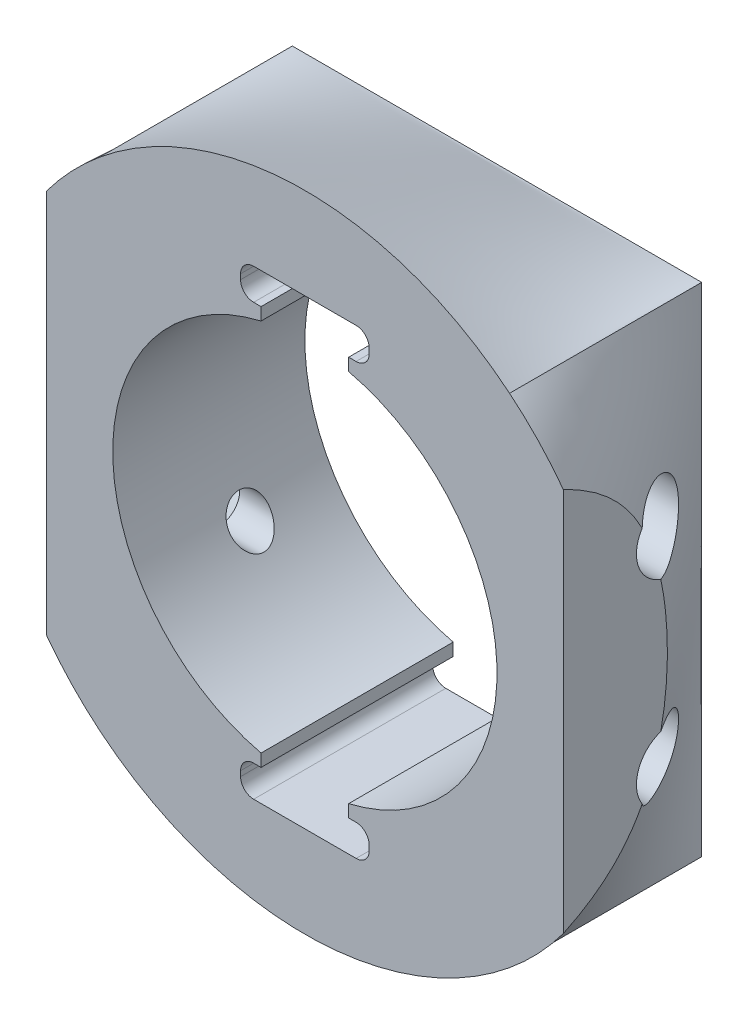
from build123d import *
from OCP.BRepAlgoAPI import BRepAlgoAPI_Cut
from OCP.TopTools import TopTools_ListOfShape

# Parameters (mm, degrees)
CUT_EXTRUDE_1_DEPTH      = 40.317962387
CUT_EXTRUDE_START        = -15
CUT_EXTRUDE_2_DEPTH      = 15
CUT_EXTRUDE_3_DEPTH      = 38.813421331
CUT_EXTRUDE_3_DEPTH_BACK = 38.813421331
SKETCH_7_R               = 1.6
SKETCH_8_R               = 2.8
CUT_EXTRUDE_4_DEPTH      = 5
CUT_EXTRUDE_5_DEPTH      = 5
SKETCH_11_R              = 15
CUT_EXTRUDE_6_DEPTH      = 37.234969525


with BuildPart() as part:
    # 放样3: read off the stored shape, not the designer's step
    # 放样3: loft between two sections, ruled curve by curve
    loft_3_from = [
        Edge.make_bspline([(-15.181140394, 19.718209352, 0), (-15.181140394, 18.099876019, 0), (-15.181140394, 16.481542685, 0), (-15.181140394, 13.244876019, 0), (-15.181140394, 11.626542685, 0), (-15.181140394, 8.389876019, 0), (-15.181140394, 6.771542685, 0), (-15.181140394, 3.534876019, 0), (-15.181140394, 1.916542685, 0), (-15.181140394, -1.320123981, 0), (-15.181140394, -2.938457315, 0), (-15.181140394, -6.175123981, 0), (-15.181140394, -7.793457315, 0), (-15.181140394, -11.030123981, 0), (-15.181140394, -12.648457315, 0), (-15.181140394, -15.885123981, 0), (-15.181140394, -17.503457315, 0), (-15.181140394, -19.121790648, 0)], [0, 0, 0, 0, 0.125, 0.125, 0.25, 0.25, 0.375, 0.375, 0.5, 0.5, 0.625, 0.625, 0.75, 0.75, 0.875, 0.875, 1, 1, 1, 1], 3),
        Edge.make_bspline([(-15.181140394, -19.121790648, 0), (-13.849473727, -19.121790648, 0), (-12.51780706, -19.121790648, 0), (-9.854473727, -19.121790648, 0), (-8.52280706, -19.121790648, 0), (-5.859473727, -19.121790648, 0), (-4.52780706, -19.121790648, 0), (-1.864473727, -19.121790648, 0), (-0.53280706, -19.121790648, 0), (2.130526273, -19.121790648, 0), (3.46219294, -19.121790648, 0), (6.125526273, -19.121790648, 0), (7.45719294, -19.121790648, 0), (10.120526273, -19.121790648, 0), (11.45219294, -19.121790648, 0), (14.115526273, -19.121790648, 0), (15.44719294, -19.121790648, 0), (16.778859606, -19.121790648, 0)], [0, 0, 0, 0, 0.125, 0.125, 0.25, 0.25, 0.375, 0.375, 0.5, 0.5, 0.625, 0.625, 0.75, 0.75, 0.875, 0.875, 1, 1, 1, 1], 3),
        Edge.make_bspline([(16.778859606, 19.718209352, 0), (15.44719294, 19.718209352, 0), (14.115526273, 19.718209352, 0), (11.45219294, 19.718209352, 0), (10.120526273, 19.718209352, 0), (7.45719294, 19.718209352, 0), (6.125526273, 19.718209352, 0), (3.46219294, 19.718209352, 0), (2.130526273, 19.718209352, 0), (-0.53280706, 19.718209352, 0), (-1.864473727, 19.718209352, 0), (-4.52780706, 19.718209352, 0), (-5.859473727, 19.718209352, 0), (-8.52280706, 19.718209352, 0), (-9.854473727, 19.718209352, 0), (-12.51780706, 19.718209352, 0), (-13.849473727, 19.718209352, 0), (-15.181140394, 19.718209352, 0)], [0, 0, 0, 0, 0.125, 0.125, 0.25, 0.25, 0.375, 0.375, 0.5, 0.5, 0.625, 0.625, 0.75, 0.75, 0.875, 0.875, 1, 1, 1, 1], 3),
        Edge.make_bspline([(16.778859606, -19.121790648, 0), (16.778859606, -17.503457315, 0), (16.778859606, -15.885123981, 0), (16.778859606, -12.648457315, 0), (16.778859606, -11.030123981, 0), (16.778859606, -7.793457315, 0), (16.778859606, -6.175123981, 0), (16.778859606, -2.938457315, 0), (16.778859606, -1.320123981, 0), (16.778859606, 1.916542685, 0), (16.778859606, 3.534876019, 0), (16.778859606, 6.771542685, 0), (16.778859606, 8.389876019, 0), (16.778859606, 11.626542685, 0), (16.778859606, 13.244876019, 0), (16.778859606, 16.481542685, 0), (16.778859606, 18.099876019, 0), (16.778859606, 19.718209352, 0)], [0, 0, 0, 0, 0.125, 0.125, 0.25, 0.25, 0.375, 0.375, 0.5, 0.5, 0.625, 0.625, 0.75, 0.75, 0.875, 0.875, 1, 1, 1, 1], 3),
    ]
    loft_3_to = [
        Edge.make_bspline([(-15.181140394, 19.718209352, 15), (-16.430789373, 18.689919409, 15), (-17.63903555, 17.492204447, 15), (-19.85250445, 14.758866588, 15), (-20.856777376, 13.222778026, 15), (-22.533609134, 9.869363461, 15), (-23.204915411, 8.052280211, 15), (-24.113887346, 4.255717312, 15), (-24.350629454, 2.277337097, 15), (-24.350629454, -1.680918393, 15), (-24.113887346, -3.659298608, 15), (-23.204915411, -7.455861507, 15), (-22.533609134, -9.272944757, 15), (-20.856777376, -12.626359322, 15), (-19.85250445, -14.162447884, 15), (-17.63903555, -16.895785743, 15), (-16.430789373, -18.093500705, 15), (-15.181140394, -19.121790648, 15)], [0, 0, 0, 0, 0.125, 0.125, 0.25, 0.25, 0.375, 0.375, 0.5, 0.5, 0.625, 0.625, 0.75, 0.75, 0.875, 0.875, 1, 1, 1, 1], 3),
        Edge.make_bspline([(-15.181140394, -19.121790648, 15), (-14.152850451, -19.967932424, 15), (-13.027231039, -20.756487288, 15), (-10.602248128, -22.162328833, 15), (-9.302885285, -22.779304834, 15), (-6.57211611, -23.790909101, 15), (-5.140880137, -24.18523412, 15), (-2.206659135, -24.715514273, 15), (-0.703995238, -24.851279708, 15), (2.30171445, -24.851279708, 15), (3.804378347, -24.715514273, 15), (6.738599349, -24.18523412, 15), (8.169835322, -23.790909101, 15), (10.900604498, -22.779304834, 15), (12.19996734, -22.162328833, 15), (14.624950251, -20.756487288, 15), (15.750569663, -19.967932424, 15), (16.778859606, -19.121790648, 15)], [0, 0, 0, 0, 0.125, 0.125, 0.25, 0.25, 0.375, 0.375, 0.5, 0.5, 0.625, 0.625, 0.75, 0.75, 0.875, 0.875, 1, 1, 1, 1], 3),
        Edge.make_bspline([(16.778859606, 19.718209352, 15), (15.750569663, 20.564351128, 15), (14.624950251, 21.352905993, 15), (12.19996734, 22.758747538, 15), (10.900604498, 23.375723538, 15), (8.169835322, 24.387327806, 15), (6.738599349, 24.781652824, 15), (3.804378347, 25.311932977, 15), (2.30171445, 25.447698412, 15), (-0.703995238, 25.447698412, 15), (-2.206659135, 25.311932977, 15), (-5.140880137, 24.781652824, 15), (-6.57211611, 24.387327806, 15), (-9.302885285, 23.375723538, 15), (-10.602248128, 22.758747538, 15), (-13.027231039, 21.352905993, 15), (-14.152850451, 20.564351128, 15), (-15.181140394, 19.718209352, 15)], [0, 0, 0, 0, 0.125, 0.125, 0.25, 0.25, 0.375, 0.375, 0.5, 0.5, 0.625, 0.625, 0.75, 0.75, 0.875, 0.875, 1, 1, 1, 1], 3),
        Edge.make_bspline([(16.778859606, -19.121790648, 15), (18.028508585, -18.093500705, 15), (19.236754762, -16.895785743, 15), (21.450223663, -14.162447884, 15), (22.454496588, -12.626359322, 15), (24.131328346, -9.272944757, 15), (24.802634623, -7.455861507, 15), (25.711606558, -3.659298608, 15), (25.948348667, -1.680918393, 15), (25.948348667, 2.277337097, 15), (25.711606558, 4.255717312, 15), (24.802634623, 8.052280211, 15), (24.131328346, 9.869363461, 15), (22.454496588, 13.222778026, 15), (21.450223663, 14.758866588, 15), (19.236754762, 17.492204447, 15), (18.028508585, 18.689919409, 15), (16.778859606, 19.718209352, 15)], [0, 0, 0, 0, 0.125, 0.125, 0.25, 0.25, 0.375, 0.375, 0.5, 0.5, 0.625, 0.625, 0.75, 0.75, 0.875, 0.875, 1, 1, 1, 1], 3),
    ]
    loft_3 = Solid(Shell([*[Face.make_surface_from_curves(loft_3_from[k], loft_3_to[k]) for k in range(4)], Face(Wire(loft_3_from)), Face(Wire(loft_3_to))]))
    add(loft_3)

    # 草图5 → 切除-拉伸1 (cut, through all)
    with BuildSketch(Plane(origin=(0, 0, 0), x_dir=(-1, 0, 0), z_dir=(0, 0, -1))):
        with BuildLine():
            Line((-4.798859606, -17.721790648), (3.201140394, -17.721790648))
            ThreePointArc((3.201140394, -17.721790648), (3.922389311, -17.423039565), (4.221140394, -16.701790648))
            Line((4.221140394, -16.701790648), (4.221140394, -16.301790648))
            ThreePointArc((4.221140394, -16.301790648), (3.922389311, -15.580541731), (3.201140394, -15.281790648))
            Line((3.201140394, -15.281790648), (2.621140394, -15.281790648))
            Line((2.621140394, -15.281790648), (2.621140394, 15.878209352))
            Line((2.621140394, 15.878209352), (3.201140394, 15.878209352))
            ThreePointArc((3.201140394, 15.878209352), (3.922389311, 16.176960435), (4.221140394, 16.898209352))
            Line((4.221140394, 16.898209352), (4.221140394, 17.298209352))
            ThreePointArc((4.221140394, 17.298209352), (3.922389311, 18.019458269), (3.201140394, 18.318209352))
            Line((3.201140394, 18.318209352), (-4.798859606, 18.318209352))
            ThreePointArc((-4.798859606, 18.318209352), (-5.520108523, 18.019458269), (-5.818859606, 17.298209352))
            Line((-5.818859606, 17.298209352), (-5.818859606, 16.898209352))
            ThreePointArc((-5.818859606, 16.898209352), (-5.520108523, 16.176960435), (-4.798859606, 15.878209352))
            Line((-4.798859606, 15.878209352), (-4.218859606, 15.878209352))
            Line((-4.218859606, 15.878209352), (-4.218859606, -15.281790648))
            Line((-4.218859606, -15.281790648), (-4.798859606, -15.281790648))
            ThreePointArc((-4.798859606, -15.281790648), (-5.520108523, -15.580541731), (-5.818859606, -16.301790648))
            Line((-5.818859606, -16.301790648), (-5.818859606, -16.701790648))
            ThreePointArc((-5.818859606, -16.701790648), (-5.520108523, -17.423039565), (-4.798859606, -17.721790648))
        make_face()
    extrude(amount=-CUT_EXTRUDE_1_DEPTH, mode=Mode.SUBTRACT)

    # 切除-拉伸2: read off the stored shape, not the designer's step
    # 切除-拉伸2 outline → 切除-拉伸2 (cut)
    with BuildSketch(Plane.XY.offset(15).offset(CUT_EXTRUDE_START)):
        with BuildLine():
            Line((-19.387695955, -14.701783134), (-19.387694679, 15.298203556))
            ThreePointArc((-19.387694679, 15.298203556), (-24.350629454, 0.298210422), (-19.387695955, -14.701783134))
        make_face()
        with BuildLine():
            ThreePointArc((20.985413891, -14.701784851), (25.948348667, 0.298208282), (20.985415167, 15.298201838))
            Line((20.985415167, 15.298201838), (20.985413891, -14.701784851))
        make_face()
    extrude(amount=CUT_EXTRUDE_2_DEPTH, mode=Mode.SUBTRACT)

    # 草图7 → 切除-拉伸3 (cut, two sides: drawn at the far end of the back side and taken through both)
    with BuildSketch(Plane(origin=(-2.621140394, 0, 0), x_dir=(0, 0, -1), z_dir=(1, 0, 0)).offset(-CUT_EXTRUDE_3_DEPTH_BACK)):
        with Locations(Location((-6.5, 8.098209352, 0), (0, 0, 209.390902735))):
            Circle(SKETCH_7_R)
        with Locations(Location((-6.5, -7.501790648, 0), (0, 0, 150.609095719))):
            Circle(SKETCH_7_R)
    extrude(amount=CUT_EXTRUDE_3_DEPTH + CUT_EXTRUDE_3_DEPTH_BACK, mode=Mode.SUBTRACT)


with BuildPart() as cut_extrude_4_tool:
    # 草图8 → 切除-拉伸4 (new body)
    with BuildSketch(Plane(origin=(20.985409584, 0, 0), x_dir=(0, 0, -1), z_dir=(1, 0, 0))):
        with Locations(Location((-6.5, 8.098209352, 0), (0, 0, 90))):
            Circle(SKETCH_8_R)
        with Locations(Location((-6.5, -7.501790648, 0), (0, 0, 90))):
            Circle(SKETCH_8_R)
    extrude(amount=-CUT_EXTRUDE_4_DEPTH)


with BuildPart() as part_1:
    add(part.part)

    # 切除-拉伸4: cut by cut_extrude_4_tool, with a tolerance
    cut_extrude_4_stock = TopTools_ListOfShape()
    cut_extrude_4_stock.Append(part_1.part.wrapped)
    cut_extrude_4_tools = TopTools_ListOfShape()
    cut_extrude_4_tools.Append(cut_extrude_4_tool.part.wrapped)
    cut_extrude_4_cut = BRepAlgoAPI_Cut()
    cut_extrude_4_cut.SetArguments(cut_extrude_4_stock)
    cut_extrude_4_cut.SetTools(cut_extrude_4_tools)
    cut_extrude_4_cut.SetFuzzyValue(0.00001)
    cut_extrude_4_cut.Build()
    add(Compound.cast(cut_extrude_4_cut.Shape()).solids(), mode=Mode.REPLACE)


with BuildPart() as cut_extrude_5_tool:
    # 草图10 → 切除-拉伸5 (new body)
    with BuildSketch(Plane.ZY.offset(19.387690371)):
        Polygon((3.266838493, 8.098209352), (4.883419246, 5.298209352), (8.116580754, 5.298209352), (9.733161507, 8.098209352), (8.116580754, 10.898209352), (4.883419246, 10.898209352), align=None)
        Polygon((9.733161507, -7.501790648), (8.116580754, -4.701790648), (4.883419246, -4.701790648), (3.266838493, -7.501790648), (4.883419246, -10.301790648), (8.116580754, -10.301790648), align=None)
    extrude(amount=-CUT_EXTRUDE_5_DEPTH)


with BuildPart() as part_2:
    add(part_1.part)

    # 切除-拉伸5: cut by cut_extrude_5_tool, with a tolerance
    cut_extrude_5_stock = TopTools_ListOfShape()
    cut_extrude_5_stock.Append(part_2.part.wrapped)
    cut_extrude_5_tools = TopTools_ListOfShape()
    cut_extrude_5_tools.Append(cut_extrude_5_tool.part.wrapped)
    cut_extrude_5_cut = BRepAlgoAPI_Cut()
    cut_extrude_5_cut.SetArguments(cut_extrude_5_stock)
    cut_extrude_5_cut.SetTools(cut_extrude_5_tools)
    cut_extrude_5_cut.SetFuzzyValue(0.00001)
    cut_extrude_5_cut.Build()
    add(Compound.cast(cut_extrude_5_cut.Shape()).solids(), mode=Mode.REPLACE)

    # 草图11 → 切除-拉伸6 (cut, through all)
    with BuildSketch(Plane.XY.offset(15)):
        with Locations((0.798945617, 0.298299727)):
            Circle(SKETCH_11_R)
    extrude(amount=-CUT_EXTRUDE_6_DEPTH, mode=Mode.SUBTRACT)


solid = part_2.part
